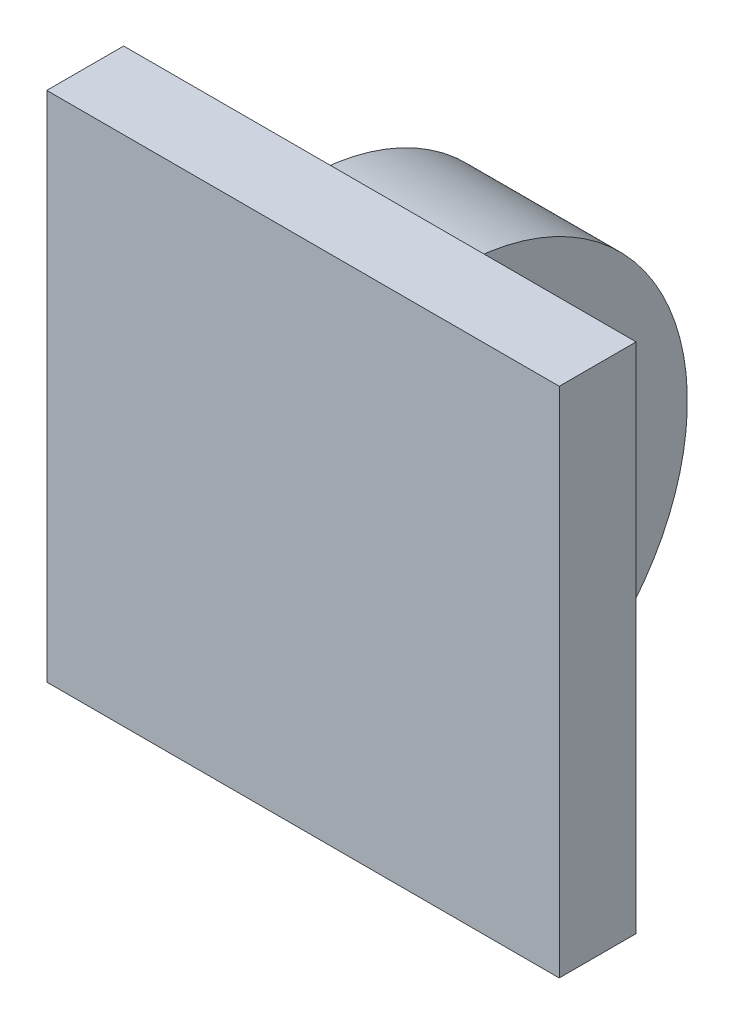
from build123d import *

# Parameters (mm, degrees)
CROQUIS1_W              = 10
CROQUIS1_H              = 10
SALIENTE_EXTRUIR6_DEPTH = 1.5
SALIENTE_EXTRUIR7_DEPTH = 1.5


with BuildPart() as part:
    # Croquis1 → Saliente-Extruir6 (new body)
    with BuildSketch(Plane.XY):
        Rectangle(CROQUIS1_W, CROQUIS1_H)
    extrude(amount=SALIENTE_EXTRUIR6_DEPTH)

    # Croquis8 → Saliente-Extruir7 (add, symmetric)
    with BuildSketch(Plane(origin=(0, 0, 0), x_dir=(0, 0, -1), z_dir=(1, 0, 0))):
        with BuildLine():
            Line((0, 4.5), (0, 2.5))
            ThreePointArc((0, 2.5), (2.5, 0), (0, -2.5))
            Line((0, -2.5), (0, -4.5))
            ThreePointArc((0, -4.5), (4.5, 0), (0, 4.5))
        make_face()
    extrude(amount=SALIENTE_EXTRUIR7_DEPTH, both=True)


solid = part.part
